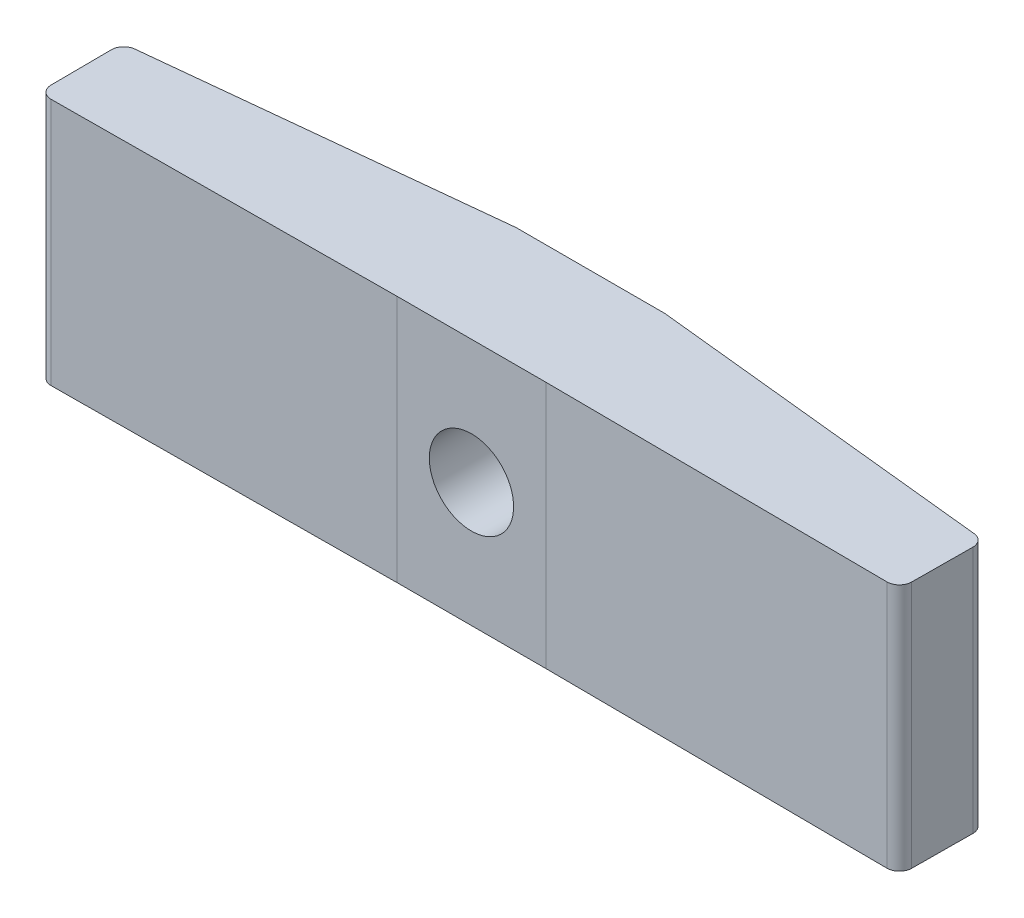
from build123d import *

# Parameters (mm, degrees)
BOSS_EXTRUDE1_DEPTH       = 10
FILLET2_R                 = 0.5
SKETCH2_R                 = 1.7
CUT_EXTRUDE1_DEPTH        = 37.462201721
REVISION_INDICATION_DEPTH = 0.4


with BuildPart() as part:
    # Sketch1 → Boss-Extrude1 (new body)
    with BuildSketch(Plane(origin=(0, 0, 0), x_dir=(1, 0, 0), z_dir=(0, 1, 0))):
        Polygon((20.35, 0.1), (14.35, 0.1), (0, 0), (-0.02369338, 3.4), (14.35, 4.9), (20.35, 4.9), (34.72369338, 3.4), (34.7, 0), align=None)
    extrude(amount=BOSS_EXTRUDE1_DEPTH)

    # Fillet2
    fillet2_edges = [part.edges().sort_by_distance(p)[0] for p in [
        (-0.02369338, 5, -3.4),
        (34.72369338, 5, -3.4),
        (34.7, 5, 0),
        (0, 5, 0),
    ]]
    fillet(fillet2_edges, radius=FILLET2_R)

    # Sketch2 → Cut-Extrude1 (cut, through all)
    with BuildSketch(Plane(origin=(0, 0, -4.9), x_dir=(-1, 0, 0), z_dir=(0, 0, -1))):
        with Locations((-17.35, 5)):
            Circle(SKETCH2_R)
    extrude(amount=-CUT_EXTRUDE1_DEPTH, mode=Mode.SUBTRACT)

    # Sketch5 → revision indication (add)
    with BuildSketch(Plane(origin=(-0.351247647, 0, -3.365817317), x_dir=(-0.9945988516257159, 0, 0.1037936623537653), z_dir=(-0.1037936623537653, 0, -0.9945988516257159))):
        with BuildLine():
            add(Edge.make_bspline(
                [(-1.88207467, 1.976923077), (-1.846713856, 1.974821832), (-1.777393115, 1.970702586), (-1.677173554, 1.942442049), (-1.586468957, 1.892261337), (-1.505674742, 1.825381725), (-1.439078706, 1.744291021), (-1.387109667, 1.654309873), (-1.359095308, 1.553251269), (-1.355006068, 1.483528859), (-1.352908003, 1.44775641)],
                knots=[0, 0, 0, 0, 1.020151414, 1.999887582, 2.974338812, 3.990962822, 5.007586832, 5.987933904, 6.967670073, 8, 8, 8, 8], degree=3))
            add(Edge.make_bspline(
                [(-1.352908003, 1.44775641), (-1.355077165, 1.412843512), (-1.359354719, 1.343995789), (-1.387045451, 1.243699421), (-1.43947477, 1.153662038), (-1.5052154, 1.071471016), (-1.58648893, 1.004449722), (-1.677387994, 0.954695939), (-1.777157848, 0.924411918), (-1.846674606, 0.920554208), (-1.88207467, 0.918589744)],
                knots=[0, 0, 0, 0, 1.009421747, 1.99056486, 2.972319754, 3.999869655, 5.017953583, 5.993804169, 6.978383603, 8, 8, 8, 8], degree=3))
            add(Edge.make_bspline(
                [(-1.88207467, 0.918589744), (-1.917500242, 0.920483127), (-1.986660237, 0.924179507), (-2.086057684, 0.955317742), (-2.177510327, 1.003983162), (-2.258768032, 1.071595984), (-2.325059259, 1.153239101), (-2.375179597, 1.244319503), (-2.405278867, 1.343708683), (-2.409237408, 1.412786963), (-2.411241337, 1.44775641)],
                knots=[0, 0, 0, 0, 1.022052826, 1.995314843, 2.982371812, 4.00089066, 5.028879526, 6.005146991, 6.990147033, 8, 8, 8, 8], degree=3))
            add(Edge.make_bspline(
                [(-2.411241337, 1.44775641), (-2.409314385, 1.483587428), (-2.405552249, 1.553543092), (-2.375116408, 1.653690044), (-2.325448138, 1.744709926), (-2.258309778, 1.825258007), (-2.177529984, 1.892726399), (-2.086278298, 1.941829667), (-1.986420846, 1.970931558), (-1.917459958, 1.974891267), (-1.88207467, 1.976923077)],
                knots=[0, 0, 0, 0, 1.032775665, 2.016367738, 2.991239715, 4.008302682, 5.025365648, 6.011011707, 6.979408107, 8, 8, 8, 8], degree=3))
        make_face()
        with BuildLine():
            add(Edge.make_bspline(
                [(-4.242972106, 1.976923077), (-4.207611292, 1.974821832), (-4.138290551, 1.970702586), (-4.03807099, 1.942442049), (-3.947366393, 1.892261337), (-3.866572178, 1.825381725), (-3.799976142, 1.744291021), (-3.748007103, 1.654309873), (-3.719992744, 1.553251269), (-3.715903504, 1.483528859), (-3.713805439, 1.44775641)],
                knots=[0, 0, 0, 0, 1.020151414, 1.999887582, 2.974338812, 3.990962822, 5.007586832, 5.987933904, 6.967670073, 8, 8, 8, 8], degree=3))
            add(Edge.make_bspline(
                [(-3.713805439, 1.44775641), (-3.7159746, 1.412843512), (-3.720252155, 1.343995789), (-3.747942887, 1.243699421), (-3.800372206, 1.153662038), (-3.866112836, 1.071471016), (-3.947386366, 1.004449722), (-4.03828543, 0.954695939), (-4.138055284, 0.924411918), (-4.207572042, 0.920554208), (-4.242972106, 0.918589744)],
                knots=[0, 0, 0, 0, 1.009421747, 1.99056486, 2.972319754, 3.999869655, 5.017953583, 5.993804169, 6.978383603, 8, 8, 8, 8], degree=3))
            add(Edge.make_bspline(
                [(-4.242972106, 0.918589744), (-4.278397677, 0.920483127), (-4.347557673, 0.924179507), (-4.44695512, 0.955317742), (-4.538407763, 1.003983162), (-4.619665468, 1.071595984), (-4.685956695, 1.153239101), (-4.736077033, 1.244319503), (-4.766176303, 1.343708683), (-4.770134843, 1.412786963), (-4.772138772, 1.44775641)],
                knots=[0, 0, 0, 0, 1.022052826, 1.995314843, 2.982371812, 4.00089066, 5.028879526, 6.005146991, 6.990147033, 8, 8, 8, 8], degree=3))
            add(Edge.make_bspline(
                [(-4.772138772, 1.44775641), (-4.770211821, 1.483587428), (-4.766449685, 1.553543092), (-4.736013844, 1.653690044), (-4.686345574, 1.744709926), (-4.619207214, 1.825258007), (-4.53842742, 1.892726399), (-4.447175734, 1.941829667), (-4.347318282, 1.970931558), (-4.278357394, 1.974891267), (-4.242972106, 1.976923077)],
                knots=[0, 0, 0, 0, 1.032775665, 2.016367738, 2.991239715, 4.008302682, 5.025365648, 6.011011707, 6.979408107, 8, 8, 8, 8], degree=3))
        make_face()
        with BuildLine():
            add(Edge.make_bspline(
                [(-6.603869542, 1.976923077), (-6.568508728, 1.974821832), (-6.499187987, 1.970702586), (-6.398968426, 1.942442049), (-6.308263829, 1.892261337), (-6.227469613, 1.825381725), (-6.160873577, 1.744291021), (-6.108904539, 1.654309873), (-6.08089018, 1.553251269), (-6.07680094, 1.483528859), (-6.074702875, 1.44775641)],
                knots=[0, 0, 0, 0, 1.020151414, 1.999887582, 2.974338812, 3.990962822, 5.007586832, 5.987933904, 6.967670073, 8, 8, 8, 8], degree=3))
            add(Edge.make_bspline(
                [(-6.074702875, 1.44775641), (-6.076872036, 1.412843512), (-6.081149591, 1.343995789), (-6.108840323, 1.243699421), (-6.161269642, 1.153662038), (-6.227010272, 1.071471016), (-6.308283802, 1.004449722), (-6.399182866, 0.954695939), (-6.49895272, 0.924411918), (-6.568469478, 0.920554208), (-6.603869542, 0.918589744)],
                knots=[0, 0, 0, 0, 1.009421747, 1.99056486, 2.972319754, 3.999869655, 5.017953583, 5.993804169, 6.978383603, 8, 8, 8, 8], degree=3))
            add(Edge.make_bspline(
                [(-6.603869542, 0.918589744), (-6.639295113, 0.920483127), (-6.708455109, 0.924179507), (-6.807852556, 0.955317742), (-6.899305199, 1.003983162), (-6.980562904, 1.071595984), (-7.046854131, 1.153239101), (-7.096974469, 1.244319503), (-7.127073739, 1.343708683), (-7.131032279, 1.412786963), (-7.133036208, 1.44775641)],
                knots=[0, 0, 0, 0, 1.022052826, 1.995314843, 2.982371812, 4.00089066, 5.028879526, 6.005146991, 6.990147033, 8, 8, 8, 8], degree=3))
            add(Edge.make_bspline(
                [(-7.133036208, 1.44775641), (-7.131109257, 1.483587428), (-7.12734712, 1.553543092), (-7.09691128, 1.653690044), (-7.04724301, 1.744709926), (-6.98010465, 1.825258007), (-6.899324856, 1.892726399), (-6.80807317, 1.941829667), (-6.708215718, 1.970931558), (-6.63925483, 1.974891267), (-6.603869542, 1.976923077)],
                knots=[0, 0, 0, 0, 1.032775665, 2.016367738, 2.991239715, 4.008302682, 5.025365648, 6.011011707, 6.979408107, 8, 8, 8, 8], degree=3))
        make_face()
        with BuildLine():
            add(Edge.make_bspline(
                [(-8.964766978, 1.976923077), (-8.929406164, 1.974821832), (-8.860085423, 1.970702586), (-8.759865862, 1.942442049), (-8.669161265, 1.892261337), (-8.588367049, 1.825381725), (-8.521771013, 1.744291021), (-8.469801974, 1.654309873), (-8.441787616, 1.553251269), (-8.437698376, 1.483528859), (-8.435600311, 1.44775641)],
                knots=[0, 0, 0, 0, 1.020151414, 1.999887582, 2.974338812, 3.990962822, 5.007586832, 5.987933904, 6.967670073, 8, 8, 8, 8], degree=3))
            add(Edge.make_bspline(
                [(-8.435600311, 1.44775641), (-8.437769472, 1.412843512), (-8.442047027, 1.343995789), (-8.469737758, 1.243699421), (-8.522167078, 1.153662038), (-8.587907708, 1.071471016), (-8.669181238, 1.004449722), (-8.760080302, 0.954695939), (-8.859850156, 0.924411918), (-8.929366914, 0.920554208), (-8.964766978, 0.918589744)],
                knots=[0, 0, 0, 0, 1.009421747, 1.99056486, 2.972319754, 3.999869655, 5.017953583, 5.993804169, 6.978383603, 8, 8, 8, 8], degree=3))
            add(Edge.make_bspline(
                [(-8.964766978, 0.918589744), (-9.000192549, 0.920483127), (-9.069352545, 0.924179507), (-9.168749992, 0.955317742), (-9.260202635, 1.003983162), (-9.34146034, 1.071595984), (-9.407751567, 1.153239101), (-9.457871905, 1.244319503), (-9.487971175, 1.343708683), (-9.491929715, 1.412786963), (-9.493933644, 1.44775641)],
                knots=[0, 0, 0, 0, 1.022052826, 1.995314843, 2.982371812, 4.00089066, 5.028879526, 6.005146991, 6.990147033, 8, 8, 8, 8], degree=3))
            add(Edge.make_bspline(
                [(-9.493933644, 1.44775641), (-9.492006693, 1.483587428), (-9.488244556, 1.553543092), (-9.457808716, 1.653690044), (-9.408140445, 1.744709926), (-9.341002086, 1.825258007), (-9.260222292, 1.892726399), (-9.168970605, 1.941829667), (-9.069113154, 1.970931558), (-9.000152266, 1.974891267), (-8.964766978, 1.976923077)],
                knots=[0, 0, 0, 0, 1.032775665, 2.016367738, 2.991239715, 4.008302682, 5.025365648, 6.011011707, 6.979408107, 8, 8, 8, 8], degree=3))
        make_face()
    extrude(amount=REVISION_INDICATION_DEPTH)


solid = part.part
